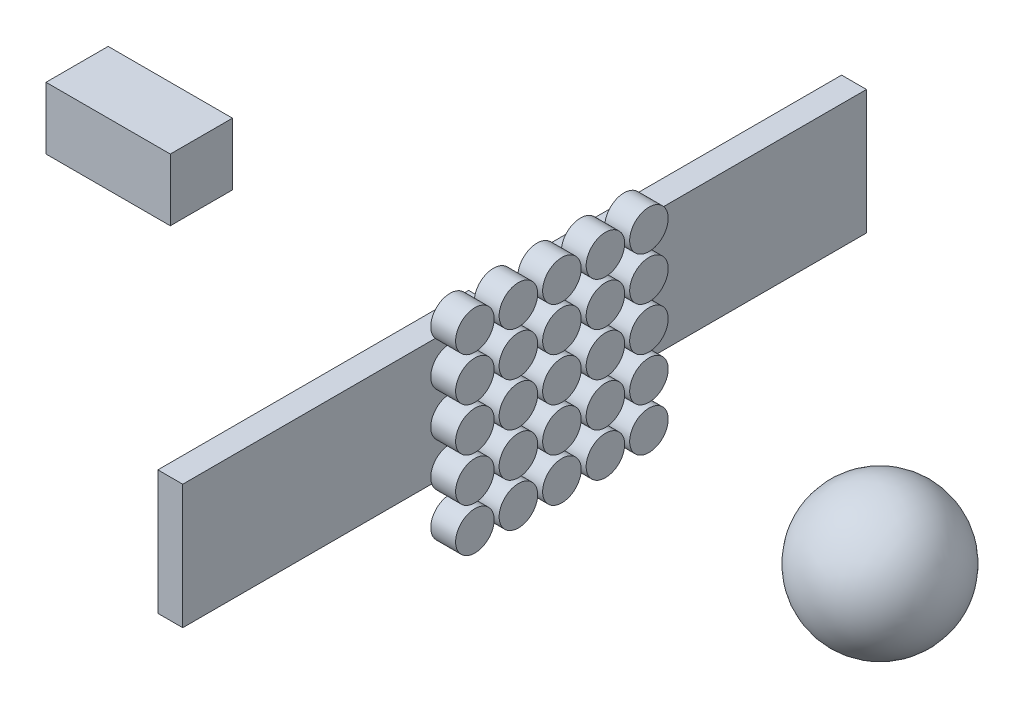
from build123d import *

# Parameters (mm, degrees)
SKETCH2_W             = 100
SKETCH2_H             = 50
BOSS_EXTRUDE2_DEPTH   = 25
SKETCH3_W             = 20
SKETCH3_H             = 15.5
SKETCH4_W             = 20
SKETCH4_H             = 250
BOSS_EXTRUDE3_DEPTH   = 50
BOSS_EXTRUDE3_2_DEPTH = 50
LPATTERN1_START       = 20
LPATTERN1_OUTLINE_R   = 15.5
LPATTERN1_DEPTH       = 20


# Read off the part's stored shape, not the designer's step: LPattern1
with BuildPart() as part:
    # Sketch2 → Boss-Extrude2 (new, symmetric)
    with BuildSketch(Plane.XY):
        with Locations((-300, 0)):
            Rectangle(SKETCH2_W, SKETCH2_H)
    extrude(amount=BOSS_EXTRUDE2_DEPTH, both=True)


with BuildPart() as body_2:
    # Sketch3 → Revolve1 (revolve)
    with BuildSketch(Plane(origin=(0, 0, 0), x_dir=(1, 0, 0), z_dir=(0, 1, 0))):
        with BuildLine():
            Line((240, 0), (351.7, 0))
            ThreePointArc((351.7, 0), (295.85, 55.85), (240, 0))
        make_face()
        with Locations((30, 7.75)):
            Rectangle(SKETCH3_W, SKETCH3_H)
    revolve(axis=Axis((0, 0, 0), (1, 0, 0)))


with BuildPart() as body_3:
    # Sketch4 → Boss-Extrude3 (new, symmetric)
    with BuildSketch(Plane(origin=(0, 0, 0), x_dir=(1, 0, 0), z_dir=(0, 1, 0))):
        with Locations((0, 150)):
            Rectangle(SKETCH4_W, SKETCH4_H)
    extrude(amount=BOSS_EXTRUDE3_DEPTH, both=True)


with BuildPart() as body_4:
    # Sketch4 → Boss-Extrude3 2 (new, symmetric)
    with BuildSketch(Plane(origin=(0, 0, 0), x_dir=(1, 0, 0), z_dir=(0, 1, 0))):
        with Locations((0, -150)):
            Rectangle(SKETCH4_W, SKETCH4_H)
    extrude(amount=BOSS_EXTRUDE3_2_DEPTH, both=True)


with BuildPart() as body_5:
    # LPattern1 outline → LPattern1 (new body)
    with BuildSketch(Plane.YZ.offset(LPATTERN1_START)):
        with Locations((70, 70)):
            Circle(LPATTERN1_OUTLINE_R)
        with Locations((70, 35)):
            Circle(LPATTERN1_OUTLINE_R)
        with Locations((70, 0)):
            Circle(LPATTERN1_OUTLINE_R)
        with Locations((35, 70)):
            Circle(LPATTERN1_OUTLINE_R)
        with Locations((35, 35)):
            Circle(LPATTERN1_OUTLINE_R)
        with Locations((35, 0)):
            Circle(LPATTERN1_OUTLINE_R)
        with Locations((0, 70)):
            Circle(LPATTERN1_OUTLINE_R)
        with Locations((0, 35)):
            Circle(LPATTERN1_OUTLINE_R)
    extrude(amount=LPATTERN1_DEPTH)

    # Mirror1: body 5 across plane


with BuildPart() as body_5_1:
    add(body_5.part)
    add(body_5.part.mirror(Plane.XY))

    # Mirror2: body 5 across plane


with BuildPart() as body_5_2:
    add(body_5_1.part)
    add(body_5_1.part.mirror(Plane.ZX))


solid = Compound([part.part, body_2.part, body_3.part, body_4.part, body_5_2.part])
